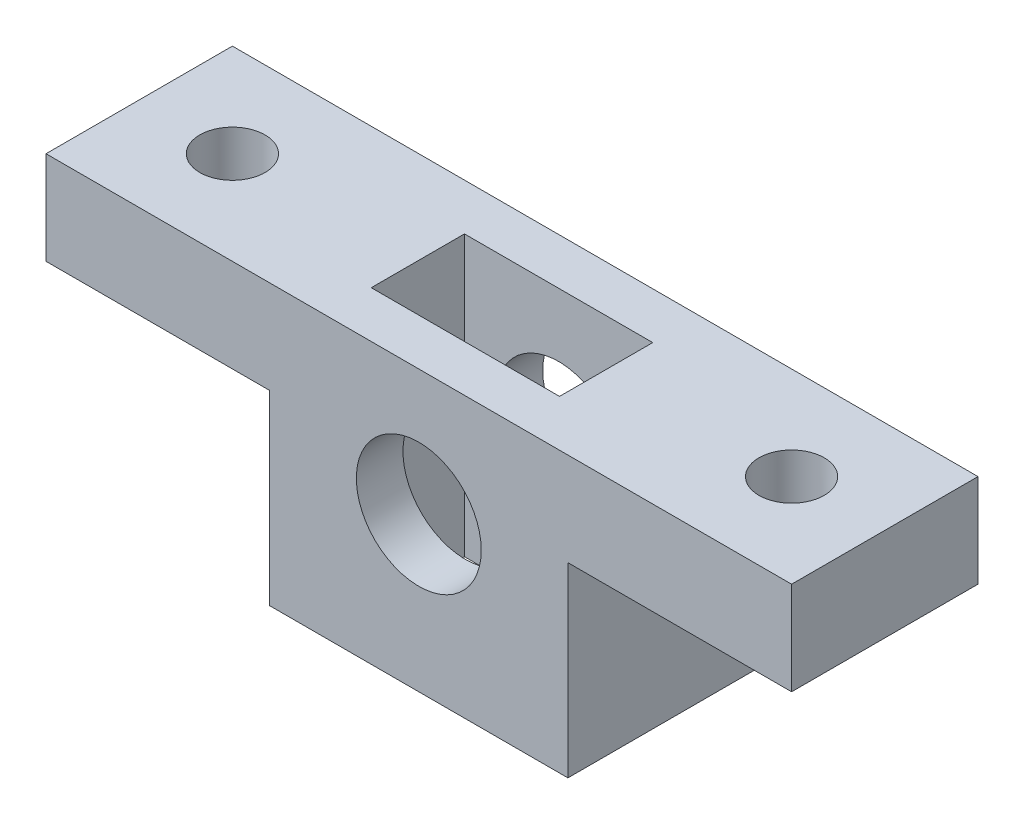
from build123d import *

# Parameters (mm, degrees)
ESBO_O1_R                = 3.35
RESSALTO_EXTRUS_O1_DEPTH = 10
ESBO_O2_R                = 1.75
CORTE_EXTRUS_O1_DEPTH    = 10
ESBO_O3_W                = 10.1
ESBO_O3_H                = 5
CORTE_EXTRUS_O2_DEPTH    = 20


with BuildPart() as part:
    # Esboço1 → Ressalto-extrusão1 (new body)
    with BuildSketch(Plane.XY):
        Polygon((-8, -5), (-8, -15), (8, -15), (8, -5), (20, -5), (20, 0), (-20, 0), (-20, -5), align=None)
        with Locations((0, -6.75)):
            Circle(ESBO_O1_R, mode=Mode.SUBTRACT)
    extrude(amount=RESSALTO_EXTRUS_O1_DEPTH)

    # Esboço2 → Corte-extrusão1 (cut)
    with BuildSketch(Plane(origin=(0, 0, 0), x_dir=(1, 0, 0), z_dir=(0, 1, 0))):
        with Locations((-15, -5)):
            Circle(ESBO_O2_R)
        with Locations((15, -5)):
            Circle(ESBO_O2_R)
    extrude(amount=-CORTE_EXTRUS_O1_DEPTH, mode=Mode.SUBTRACT)

    # Esboço3 → Corte-extrusão2 (cut)
    with BuildSketch(Plane.XZ.offset(15)):
        with Locations((0, 5)):
            Rectangle(ESBO_O3_W, ESBO_O3_H)
    extrude(amount=-CORTE_EXTRUS_O2_DEPTH, mode=Mode.SUBTRACT)


solid = part.part
